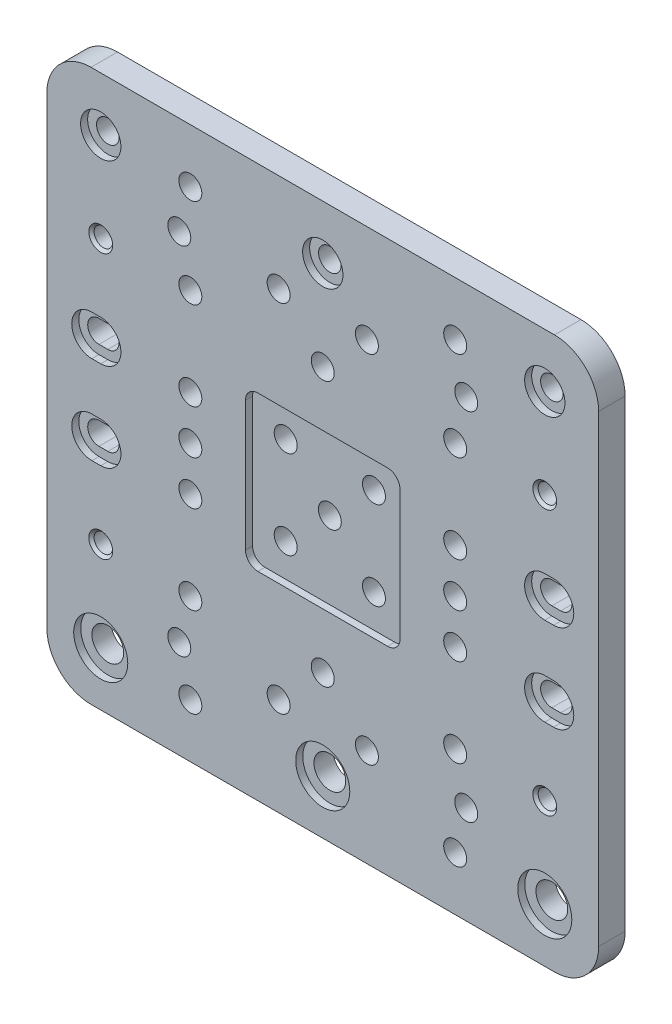
from build123d import *

# Parameters (mm, degrees)
SKETCH1_W             = 125
SKETCH1_H             = 125
BOSS_EXTRUDE1_DEPTH   = 6
M5_CLEARANCE_HOLE1_D  = 5.2
SKETCH4_R             = 2.55
SKETCH4_R_2           = 3.6
CUT_EXTRUDE1_DEPTH    = 89.591760339
SKETCH5_R             = 4.5675
SKETCH5_R_2           = 6.125
SKETCH5_W             = 35
SKETCH5_H             = 35
CUT_EXTRUDE2_DEPTH    = 1.6
FILLET1_R             = 10
FILLET2_R             = 2.8
M5X0_8_TAPPED_HOLE1_D = 4.2
CHAMFER1_SIZE         = 0.6


with BuildPart() as part:
    # Sketch1 → Boss-Extrude1 (new body)
    with BuildSketch(Plane.XY):
        Rectangle(SKETCH1_W, SKETCH1_H)
    extrude(amount=BOSS_EXTRUDE1_DEPTH)

    # M5 Clearance Hole1 (through all)
    with Locations(Plane.XY.offset(6)):
        with Locations((0, 0), (-10, 10), (-30, 30), (0, 30), (-30, 0), (-30, 10), (-30, -10), (0, -30), (-30, -30), (-10, -10), (10, -10), (30, -30), (30, -10), (30, 10), (30, 0), (30, 30), (10, 10), (-30, 50.3), (-32.5, 40.3), (-10, 40.3), (10, 40.3), (32.5, 40.3), (30, 50.3), (30, -50.3), (32.5, -40.3), (10, -40.3), (-10, -40.3), (-32.5, -40.3), (-30, -50.3)):
            Hole(M5_CLEARANCE_HOLE1_D / 2)

    # Sketch4 → Cut-Extrude1 (cut, through all)
    with BuildSketch(Plane.XY.offset(6)):
        with Locations((-50.3, 50.3)):
            Circle(SKETCH4_R)
        with Locations((0, 50.3)):
            Circle(SKETCH4_R)
        with Locations((-50.3, -50.3)):
            Circle(SKETCH4_R_2)
        with Locations((50.3, 50.3)):
            Circle(SKETCH4_R)
        with Locations((50.3, -50.3)):
            Circle(SKETCH4_R_2)
        with Locations((0, -50.3)):
            Circle(SKETCH4_R_2)
        with BuildLine():
            Line((-50.3, 7.45), (-52.3, 7.45))
            ThreePointArc((-52.3, 7.45), (-54.85, 10), (-52.3, 12.55))
            Line((-52.3, 12.55), (-50.3, 12.55))
            ThreePointArc((-50.3, 12.55), (-47.75, 10), (-50.3, 7.45))
        make_face()
        with BuildLine():
            Line((-50.3, -7.45), (-52.3, -7.45))
            ThreePointArc((-52.3, -7.45), (-54.85, -10), (-52.3, -12.55))
            Line((-52.3, -12.55), (-50.3, -12.55))
            ThreePointArc((-50.3, -12.55), (-47.75, -10), (-50.3, -7.45))
        make_face()
        with BuildLine():
            Line((50.3, 7.45), (52.3, 7.45))
            ThreePointArc((52.3, 7.45), (54.85, 10), (52.3, 12.55))
            Line((52.3, 12.55), (50.3, 12.55))
            ThreePointArc((50.3, 12.55), (47.75, 10), (50.3, 7.45))
        make_face()
        with BuildLine():
            Line((50.3, -7.45), (52.3, -7.45))
            ThreePointArc((52.3, -7.45), (54.85, -10), (52.3, -12.55))
            Line((52.3, -12.55), (50.3, -12.55))
            ThreePointArc((50.3, -12.55), (47.75, -10), (50.3, -7.45))
        make_face()
    extrude(amount=-CUT_EXTRUDE1_DEPTH, mode=Mode.SUBTRACT)

    # Sketch5 → Cut-Extrude2 (cut)
    with BuildSketch(Plane.XY.offset(6)):
        with Locations((-50.3, 50.3)):
            Circle(SKETCH5_R)
        with Locations((0, 50.3)):
            Circle(SKETCH5_R)
        with Locations((50.3, 50.3)):
            Circle(SKETCH5_R)
        with Locations((-50.3, -50.3)):
            Circle(SKETCH5_R_2)
        with Locations((0, -50.3)):
            Circle(SKETCH5_R_2)
        with Locations((50.3, -50.3)):
            Circle(SKETCH5_R_2)
        Rectangle(SKETCH5_W, SKETCH5_H)
        with BuildLine():
            Line((-50.3, 5.432), (-52.3, 5.432))
            ThreePointArc((-52.3, 5.432), (-56.868, 10), (-52.3, 14.568))
            Line((-52.3, 14.568), (-50.3, 14.568))
            ThreePointArc((-50.3, 14.568), (-45.732, 10), (-50.3, 5.432))
        make_face()
        with BuildLine():
            Line((-50.3, -14.568), (-52.3, -14.568))
            ThreePointArc((-52.3, -14.568), (-56.868, -10), (-52.3, -5.432))
            Line((-52.3, -5.432), (-50.3, -5.432))
            ThreePointArc((-50.3, -5.432), (-45.732, -10), (-50.3, -14.568))
        make_face()
        with BuildLine():
            Line((50.3, 14.568), (52.3, 14.568))
            ThreePointArc((52.3, 14.568), (56.868, 10), (52.3, 5.432))
            Line((52.3, 5.432), (50.3, 5.432))
            ThreePointArc((50.3, 5.432), (45.732, 10), (50.3, 14.568))
        make_face()
        with BuildLine():
            Line((50.3, -5.432), (52.3, -5.432))
            ThreePointArc((52.3, -5.432), (56.868, -10), (52.3, -14.568))
            Line((52.3, -14.568), (50.3, -14.568))
            ThreePointArc((50.3, -14.568), (45.732, -10), (50.3, -5.432))
        make_face()
    extrude(amount=-CUT_EXTRUDE2_DEPTH, mode=Mode.SUBTRACT)

    # Fillet1
    fillet1_edges = [part.edges().sort_by_distance(p)[0] for p in [
        (-62.5, 62.5, 3),
        (62.5, 62.5, 3),
        (62.5, -62.5, 3),
        (-62.5, -62.5, 3),
    ]]
    fillet(fillet1_edges, radius=FILLET1_R)

    # Fillet2
    fillet2_edges = [part.edges().sort_by_distance(p)[0] for p in [
        (17.5, -17.5, 5.2),
        (-17.5, -17.5, 5.2),
        (17.5, 17.5, 5.2),
        (-17.5, 17.5, 5.2),
    ]]
    fillet(fillet2_edges, radius=FILLET2_R)

    # M5x0.8 Tapped Hole1 (through all)
    with Locations(Plane.XY.offset(6)):
        with Locations((-50.3, 30), (50.3, 30), (50.3, -30), (-50.3, -30)):
            Hole(M5X0_8_TAPPED_HOLE1_D / 2)

    # Chamfer1
    chamfer1_edges = [part.edges().sort_by_distance(p)[0] for p in [
        (52.4, -30, 6),
        (52.4, 30, 6),
        (-48.2, 30, 6),
        (-48.2, -30, 6),
    ]]
    chamfer(chamfer1_edges, length=CHAMFER1_SIZE)


solid = part.part
